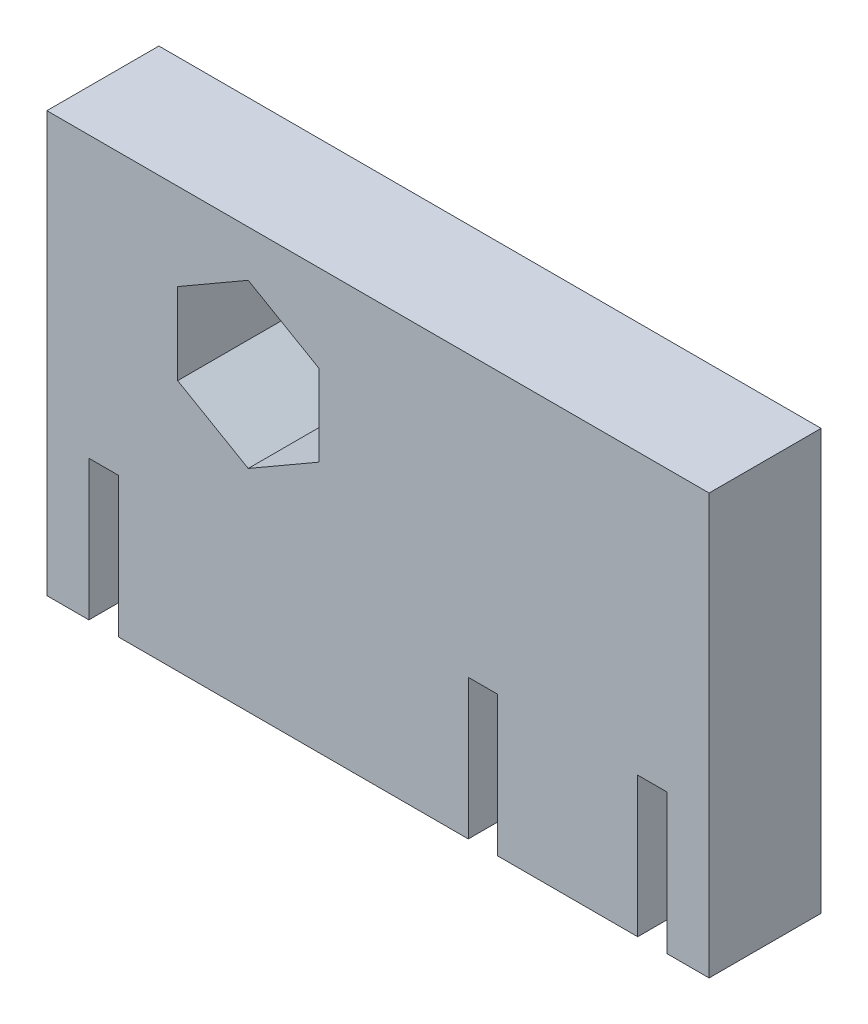
from build123d import *

# Parameters (mm, degrees)
BOSS_EXTRUDE1_DEPTH = 8


with BuildPart() as part:
    # Sketch1 → Boss-Extrude1 (new body)
    with BuildSketch(Plane.XY):
        Polygon((-20.65, -15), (-20.65, -5), (-18.55, -5), (-18.55, -15), (6.45, -15), (6.45, -5), (8.55, -5), (8.55, -15), (18.55, -15), (18.55, -5), (20.65, -5), (20.65, -15), (23.65, -15), (23.65, 15), (-23.65, 15), (-23.65, -15), align=None)
        Polygon((-4.229025772, 8.788720054), (-9.269025772, 11.69856541), (-14.309025772, 8.788720054), (-14.309025772, 2.96902934), (-9.269025772, 0.059183983), (-4.229025772, 2.96902934), align=None, mode=Mode.SUBTRACT)
    extrude(amount=BOSS_EXTRUDE1_DEPTH)


solid = part.part
